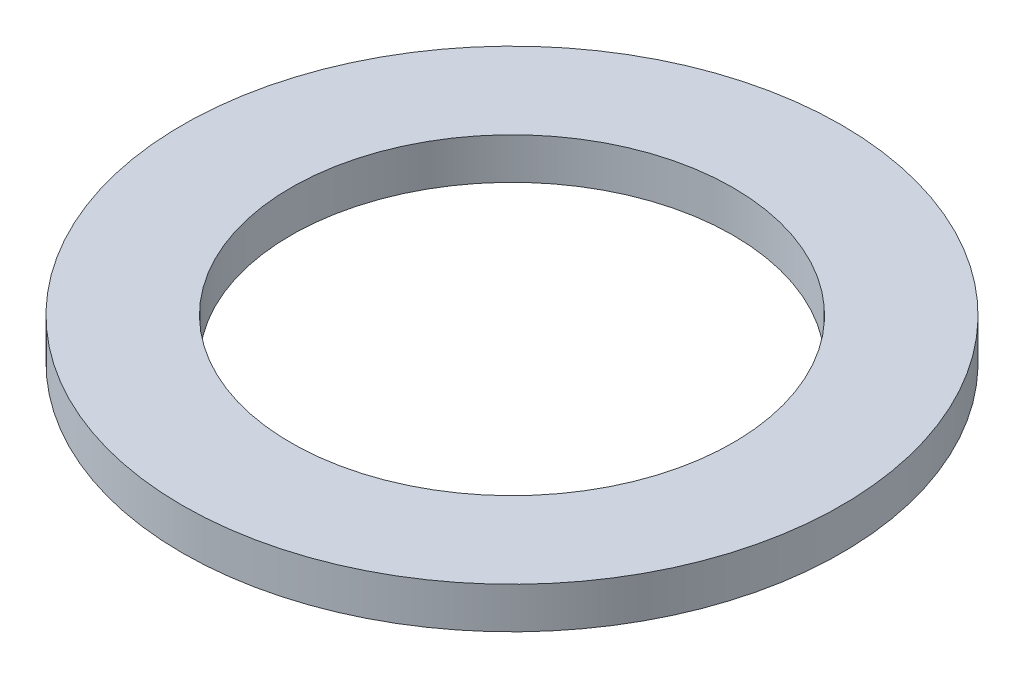
from build123d import *

# Parameters (mm, degrees)
SKETCH1_R           = 76.2
SKETCH1_R_2         = 51.1048
BOSS_EXTRUDE1_DEPTH = 9.525


with BuildPart() as part:
    # Sketch1 → Boss-Extrude1 (new body)
    with BuildSketch(Plane(origin=(0, 0, 0), x_dir=(1, 0, 0), z_dir=(0, 1, 0))):
        Circle(SKETCH1_R)
        Circle(SKETCH1_R_2, mode=Mode.SUBTRACT)
    extrude(amount=BOSS_EXTRUDE1_DEPTH)


solid = part.part
